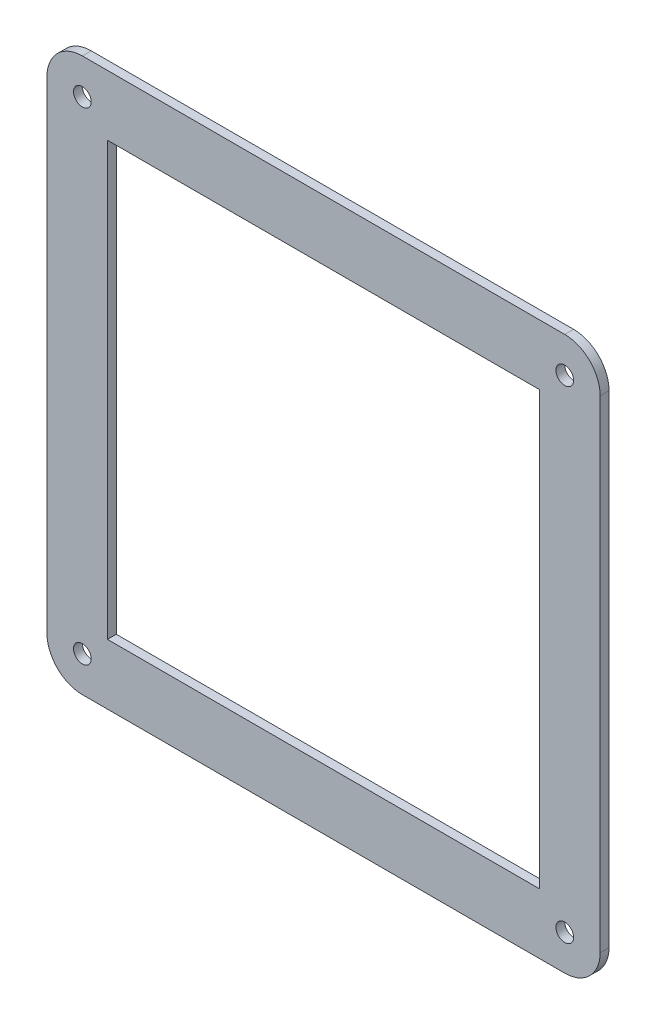
from build123d import *

# Parameters (mm, degrees)
SKETCH1_R           = 4
SKETCH1_W           = 195.372583002
SKETCH1_H           = 195.372583002
BOSS_EXTRUDE1_DEPTH = 4


with BuildPart() as part:
    # Sketch1 → Boss-Extrude1 (new body)
    with BuildSketch(Plane.XY):
        with BuildLine():
            Line((-109, 125), (109, 125))
            ThreePointArc((109, 125), (120.313708499, 120.313708499), (125, 109))
            Line((125, 109), (125, -109))
            ThreePointArc((125, -109), (120.313708499, -120.313708499), (109, -125))
            Line((109, -125), (-109, -125))
            ThreePointArc((-109, -125), (-120.313708499, -120.313708499), (-125, -109))
            Line((-125, -109), (-125, 109))
            ThreePointArc((-125, 109), (-120.313708499, 120.313708499), (-109, 125))
        make_face()
        with Locations((-109, 109)):
            Circle(SKETCH1_R, mode=Mode.SUBTRACT)
        with Locations((109, 109)):
            Circle(SKETCH1_R, mode=Mode.SUBTRACT)
        with Locations((109, -109)):
            Circle(SKETCH1_R, mode=Mode.SUBTRACT)
        with Locations((-109, -109)):
            Circle(SKETCH1_R, mode=Mode.SUBTRACT)
        Rectangle(SKETCH1_W, SKETCH1_H, mode=Mode.SUBTRACT)
    extrude(amount=BOSS_EXTRUDE1_DEPTH)


solid = part.part
